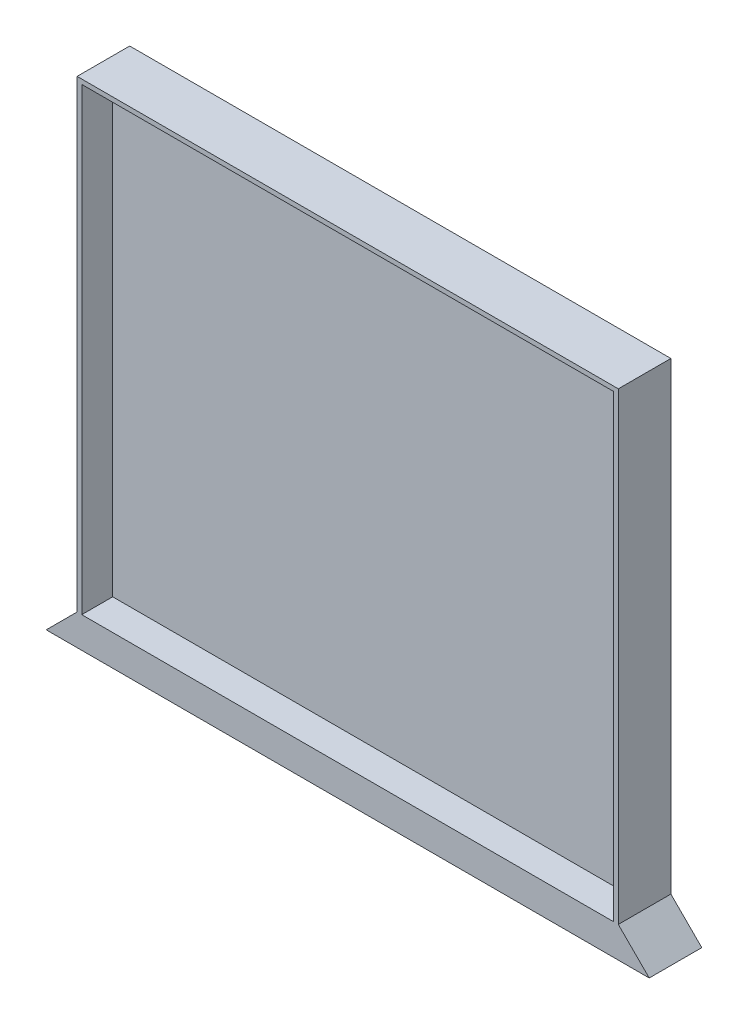
from build123d import *

# Parameters (mm, degrees)
SKETCH_1_W          = 350
SKETCH_1_H          = 320
EXTRUDE_1_DEPTH     = 34
SKETCH_2_W          = 344
SKETCH_2_H          = 314
CUT_EXTRUDE_1_DEPTH = 20
SKETCH_3_W          = 390
SKETCH_3_H          = 34
EXTRUDE_2_DEPTH     = 20
CHAMFER_1_SIZE      = 20


with BuildPart() as part:
    # 草图1 → 凸台-拉伸1 (new body)
    with BuildSketch(Plane.XY):
        Rectangle(SKETCH_1_W, SKETCH_1_H)
    extrude(amount=EXTRUDE_1_DEPTH)

    # 草图2 → 切除-拉伸1 (cut)
    with BuildSketch(Plane.XY.offset(34)):
        Rectangle(SKETCH_2_W, SKETCH_2_H)
    extrude(amount=-CUT_EXTRUDE_1_DEPTH, mode=Mode.SUBTRACT)

    # 草图3 → 凸台-拉伸2 (add)
    with BuildSketch(Plane.XZ.offset(160)):
        with Locations((0, 17)):
            Rectangle(SKETCH_3_W, SKETCH_3_H)
    extrude(amount=-EXTRUDE_2_DEPTH)

    # 倒角1
    chamfer_1_edges = [part.edges().sort_by_distance(p)[0] for p in [
        (195, -140, 17),
        (-195, -140, 17),
    ]]
    chamfer(chamfer_1_edges, length=CHAMFER_1_SIZE - 0.0001)  # a hair under: the kernel refuses the full size


solid = part.part
